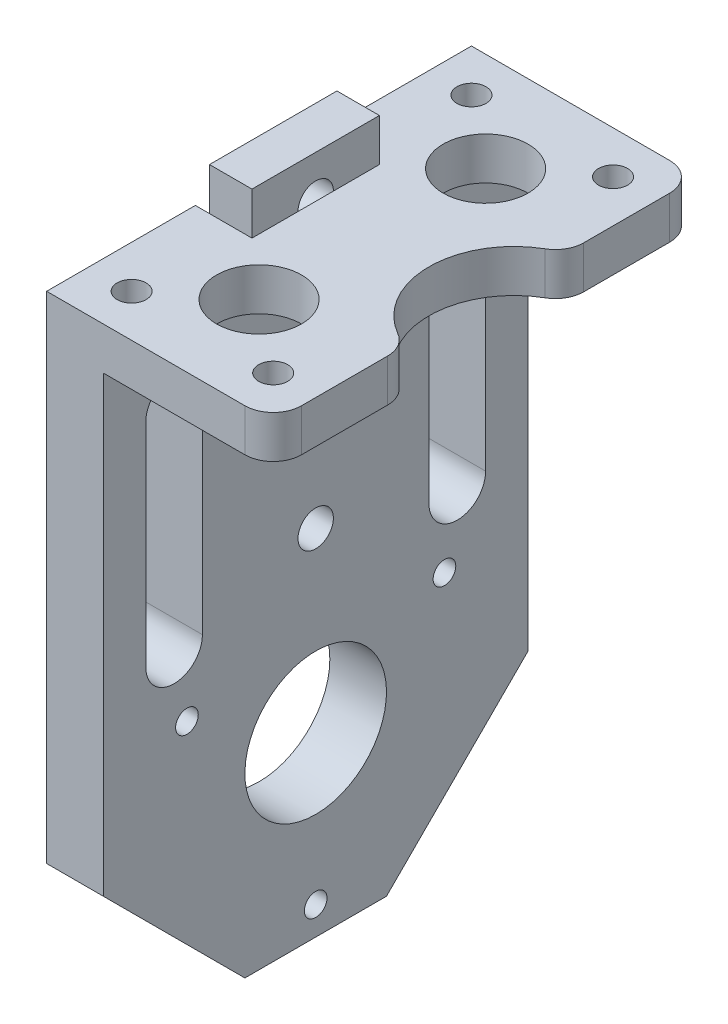
from build123d import *

# Parameters (mm, degrees)
EXTRUDE_1_DEPTH              = 30
SKETCH_3_R                   = 5
CUT_EXTRUDE_1_DEPTH          = 57.400354609
SKETCH_6_R                   = 3
CUT_EXTRUDE_3_DEPTH          = 57.400354609
SKETCH_9_W                   = 4
SKETCH_9_H                   = 9
EXTRUDE_3_DEPTH              = 3
SKETCH_10_W                  = 9
SKETCH_10_H                  = 28
CUT_EXTRUDE_4_DEPTH          = 1
HOLE_START                   = 1
HOLE_WIZARD_M3_1_OUTLINE_R   = 1.25
HOLE_WIZARD_M3_1_DEPTH       = 3
CUT_EXTRUDE_5_DEPTH          = 59.821764679
CHAMFER_1_SIZE               = 10
HOLE_START_2                 = 42
HOLE_WIZARD_M2_5_3_OUTLINE_R = 1.025
HOLE_WIZARD_M2_5_3_DEPTH     = 3
CUT_EXTRUDE_6_REACH          = 58.4
SKETCH_18_R                  = 6
FILLET_2_R                   = 2
FILLET_3_R                   = 2
HOLE_WIZARD_M2_1_D           = 1.6


# Read off the part's stored shape, not the designer's step: M3 螺纹孔1, M2.5 螺纹孔3
with BuildPart() as part:
    # 草图2 → 凸台-拉伸1 (new body)
    with BuildSketch(Plane.XY):
        Polygon((16, 42), (4, 42), (4, 0), (0, 0), (0, 45), (16, 45), align=None)
    extrude(amount=EXTRUDE_1_DEPTH)

    # 草图3 → 切除-拉伸1 (cut, through all)
    with BuildSketch(Plane(origin=(0, 0, 30), x_dir=(0, 0, -1), z_dir=(1, 0, 0))):
        with Locations(Location((15, 12.5, 0), (0, 0, 270))):
            Circle(SKETCH_3_R)
    extrude(amount=CUT_EXTRUDE_1_DEPTH, mode=Mode.SUBTRACT)

    # 草图6 → 切除-拉伸3 (cut, through all)
    with BuildSketch(Plane(origin=(0, 45, 0), x_dir=(1, 0, 0), z_dir=(0, 1, 0))):
        with Locations(Location((8, -23, 0), (0, 0, 270))):
            Circle(SKETCH_6_R)
        with Locations(Location((8, -7, 0), (0, 0, 270))):
            Circle(SKETCH_6_R)
    extrude(amount=-CUT_EXTRUDE_3_DEPTH, mode=Mode.SUBTRACT)

    # 草图9 → 凸台-拉伸3 (add)
    with BuildSketch(Plane(origin=(0, 45, 0), x_dir=(1, 0, 0), z_dir=(0, 1, 0))):
        with Locations((2, -15)):
            Rectangle(SKETCH_9_W, SKETCH_9_H)
    extrude(amount=EXTRUDE_3_DEPTH)

    # 草图10 → 切除-拉伸4 (cut)
    with BuildSketch(Plane.ZY):
        with Locations((15, 34)):
            Rectangle(SKETCH_10_W, SKETCH_10_H)
    extrude(amount=-CUT_EXTRUDE_4_DEPTH, mode=Mode.SUBTRACT)

    # M3 螺纹孔1 outline → M3 螺纹孔1 (cut)
    with BuildSketch(Plane.YZ.offset(HOLE_START)):
        with Locations((25, 15)):
            Circle(HOLE_WIZARD_M3_1_OUTLINE_R)
        with Locations((45, 15)):
            Circle(HOLE_WIZARD_M3_1_OUTLINE_R)
    extrude(amount=HOLE_WIZARD_M3_1_DEPTH, mode=Mode.SUBTRACT)

    # 草图13 → 切除-拉伸5 (cut, through all)
    with BuildSketch(Plane.ZY):
        with BuildLine():
            Line((27, 37.5), (27, 22.5))
            ThreePointArc((27, 22.5), (25, 20.5), (23, 22.5))
            Line((23, 22.5), (23, 37.5))
            ThreePointArc((23, 37.5), (25, 39.5), (27, 37.5))
        make_face()
        with BuildLine():
            Line((3, 37.5), (3, 22.5))
            ThreePointArc((3, 22.5), (5, 20.5), (7, 22.5))
            Line((7, 22.5), (7, 37.5))
            ThreePointArc((7, 37.5), (5, 39.5), (3, 37.5))
        make_face()
    extrude(amount=-CUT_EXTRUDE_5_DEPTH, mode=Mode.SUBTRACT)

    # 倒角1
    chamfer_1_edges = [part.edges().sort_by_distance(p)[0] for p in [
        (2, 0, 30),
        (2, 0, 0),
    ]]
    chamfer(chamfer_1_edges, length=CHAMFER_1_SIZE)

    # M2.5 螺纹孔3 outline → M2.5 螺纹孔3 (cut)
    with BuildSketch(Plane(origin=(0, 0, 0), x_dir=(1, 0, 0), z_dir=(0, 1, 0)).offset(HOLE_START_2)):
        with Locations((3, -27)):
            Circle(HOLE_WIZARD_M2_5_3_OUTLINE_R)
        with Locations((13, -27)):
            Circle(HOLE_WIZARD_M2_5_3_OUTLINE_R)
        with Locations((13, -3)):
            Circle(HOLE_WIZARD_M2_5_3_OUTLINE_R)
        with Locations((3, -3)):
            Circle(HOLE_WIZARD_M2_5_3_OUTLINE_R)
    extrude(amount=HOLE_WIZARD_M2_5_3_DEPTH, mode=Mode.SUBTRACT)

    # 草图18 → 切除-拉伸6 (cut, up to next)
    with BuildSketch(Plane(origin=(0, 45, 0), x_dir=(1, 0, 0), z_dir=(0, 1, 0)), mode=Mode.PRIVATE) as cut_extrude_6_sk1:
        with Locations((18, -15)):
            Circle(SKETCH_18_R)
    cut_extrude_6_tool1 = extrude(cut_extrude_6_sk1.sketch, amount=-CUT_EXTRUDE_6_REACH, mode=Mode.PRIVATE) & part.part
    add(cut_extrude_6_tool1.solids().sort_by_distance((18, 45, 15))[0], mode=Mode.SUBTRACT)

    # 圆角2
    fillet_2_edges = [part.edges().sort_by_distance(p)[0] for p in [
        (16, 43.5, 30),
        (16, 43.5, 20.656854249),
        (16, 43.5, 9.343145751),
        (16, 43.5, 0),
    ]]
    fillet(fillet_2_edges, radius=FILLET_2_R)

    # 圆角3
    fillet_3_edges = [part.edges().sort_by_distance(p)[0] for p in [
        (0.5, 20, 10.5),
        (0.5, 20, 19.5),
    ]]
    fillet(fillet_3_edges, radius=FILLET_3_R)

    # M2 螺纹孔1 (through all)
    with Locations(Plane(origin=(4, 17.75, 24.09326674), x_dir=(0, 1, 0), z_dir=(1, 0, 0))):
        with Locations((0, 0), (0, -18.18653348), (-15.75, -9.09326674)):
            Hole(HOLE_WIZARD_M2_1_D / 2)


solid = part.part
